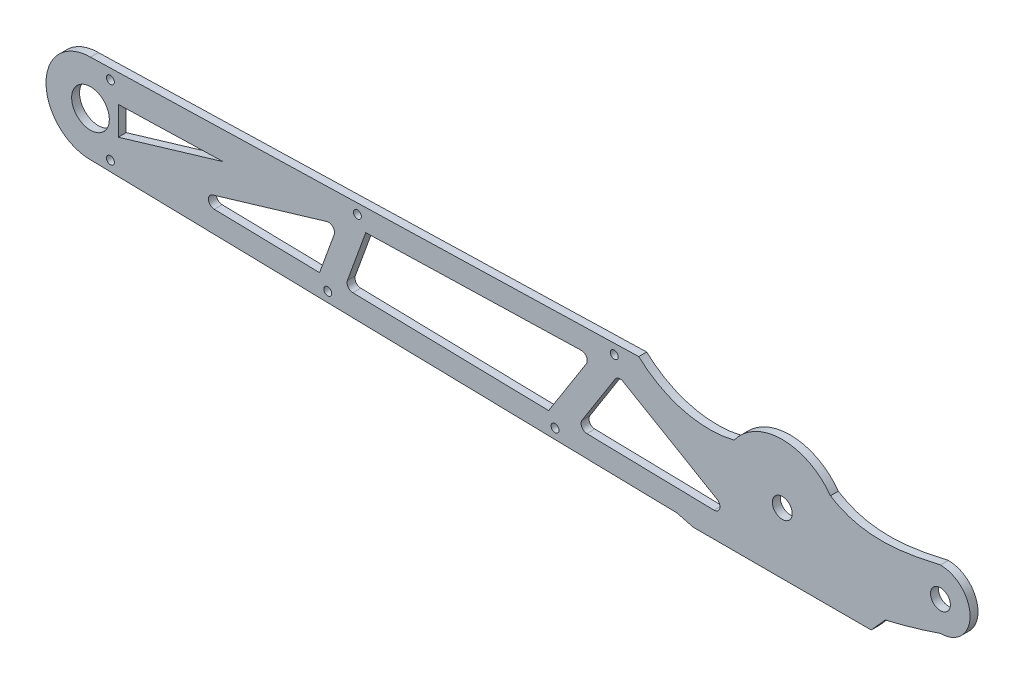
from build123d import *

# Parameters (mm, degrees)
SKETCH_1_R          = 5.03
SKETCH_1_R_2        = 9.53
EXTRUDE_1_DEPTH     = 4
SKETCH_2_R          = 2
CUT_EXTRUDE_1_DEPTH = 4
CUT_EXTRUDE_2_DEPTH = 10
EXTRUDE_2_DEPTH     = 4


with BuildPart() as part:
    # 草图1 → 凸台-拉伸1 (new body)
    with BuildSketch(Plane.XY):
        with BuildLine():
            Line((-1.457142857, -22.645714286), (348.542857143, -30.145714286))
            ThreePointArc((348.542857143, -30.145714286), (389.098872596, -25.611130034), (428.542857143, -15.145714286))
            ThreePointArc((428.542857143, -15.145714286), (443.542857143, -0.145714286), (428.542857143, 14.854285714))
            add(Edge.make_bspline(
                [(428.542857143, 14.854285714), (410.619268263, 10.804919024), (389.64255717, 6.624587059), (372.89962356, 17.3685065)],
                knots=[0, 0, 0, 0, 1, 1, 1, 1], degree=3))
            ThreePointArc((372.89962356, 17.3685065), (348.542857143, 29.854285714), (324.186090726, 17.3685065))
            ThreePointArc((324.186090726, 17.3685065), (298.479992448, 17.507996352), (275.932440805, 29.854285714))
            Line((275.932440805, 29.854285714), (-1.457142857, 22.354285714))
            ThreePointArc((-1.457142857, 22.354285714), (-23.957142857, -0.145714286), (-1.457142857, -22.645714286))
        make_face()
        with Locations((428.542857143, -0.145714286)):
            Circle(SKETCH_1_R, mode=Mode.SUBTRACT)
        with Locations((-1.457142857, -0.145714286)):
            Circle(SKETCH_1_R_2, mode=Mode.SUBTRACT)
        with Locations((348.542857143, -0.145714286)):
            Circle(SKETCH_1_R, mode=Mode.SUBTRACT)
    extrude(amount=EXTRUDE_1_DEPTH)

    # 草图2 → 切除-拉伸1 (cut)
    with BuildSketch(Plane.XY.offset(4)):
        with Locations((233.569251115, -22.681994157)):
            Circle(SKETCH_2_R)
        with Locations((118.595645086, -20.218274027)):
            Circle(SKETCH_2_R)
        with Locations((133.574547376, 20.976753342)):
            Circle(SKETCH_2_R)
        with Locations((263.527055695, 24.490381358)):
            Circle(SKETCH_2_R)
        with Locations((8.622039058, -17.754553898)):
            Circle(SKETCH_2_R)
        with Locations((8.622039058, 17.463125327)):
            Circle(SKETCH_2_R)
    extrude(amount=-CUT_EXTRUDE_1_DEPTH, mode=Mode.SUBTRACT)

    # 草图3 → 切除-拉伸2 (cut)
    with BuildSketch(Plane.XY.offset(4)):
        with BuildLine():
            Line((267.989105888, 14.937462311), (315.519299283, -12.812828637))
            ThreePointArc((315.519299283, -12.812828637), (316.894019968, -16.218057795), (313.94242528, -18.402899067))
            Line((313.94242528, -18.402899067), (249.663577857, -17.025495194))
            ThreePointArc((249.663577857, -17.025495194), (247.083369314, -15.442774062), (247.195382621, -12.41788806))
            Line((247.195382621, -12.41788806), (263.944036649, 13.954999014))
            ThreePointArc((263.944036649, 13.954999014), (265.768450061, 15.261949688), (267.989105888, 14.937462311))
        make_face()
        with BuildLine():
            Line((230.317112657, -16.610928082), (131.281754346, -14.488741833))
            ThreePointArc((131.281754346, -14.488741833), (128.8705469, -13.18412995), (128.526620689, -10.464268138))
            Line((128.526620689, -10.464268138), (137.818139447, 15.089297949))
            Line((137.818139447, 15.089297949), (246.780540012, 18.035399938))
            ThreePointArc((246.780540012, 18.035399938), (249.471008969, 16.516735307), (249.394089931, 13.428200228))
            Line((249.394089931, 13.428200228), (230.317112657, -16.610928082))
        make_face()
        with BuildLine():
            Line((114.425964747, -14.127546341), (61.132062486, -12.98553415))
            ThreePointArc((61.132062486, -12.98553415), (58.223274125, -10.38736889), (60.339455638, -7.111199137))
            Line((60.339455638, -7.111199137), (118.147452834, 10.118012745))
            ThreePointArc((118.147452834, 10.118012745), (121.187388167, 9.300720915), (121.823735259, 6.217826959))
            Line((121.823735259, 6.217826959), (114.425964747, -14.127546341))
        make_face()
        Polygon((12.622039058, -5.68094836), (65.69916173, 10.138264153), (12.622039058, 8.703176307), align=None)
    extrude(amount=-CUT_EXTRUDE_2_DEPTH, mode=Mode.SUBTRACT)

    # 草图5 → 凸台-拉伸2 (add)
    with BuildSketch(Plane.XY.offset(4)):
        Polygon((348.542857143, -31.145714286), (303.542857143, -31.145714286), (295.248317498, -29.003688436), (348.542857143, -15.645714286), (400.639440743, -23.190984086), (393.542857143, -31.145714286), align=None)
    extrude(amount=-EXTRUDE_2_DEPTH)


solid = part.part
